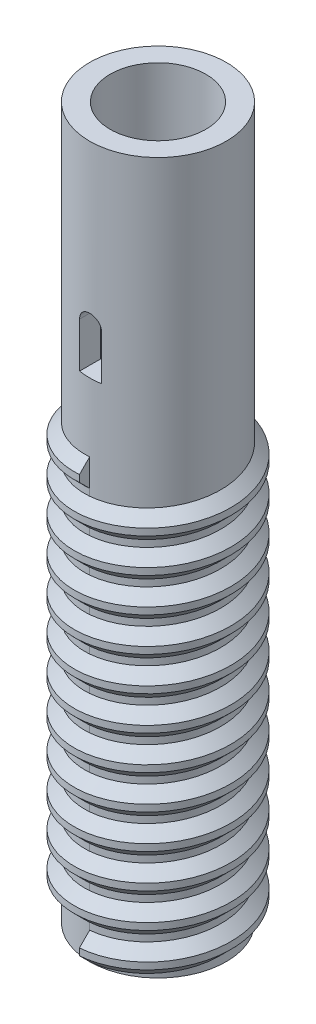
from build123d import *

# Parameters (mm, degrees)
SKETCH_1_R               = 10
EXTRUDE_1_DEPTH          = 14
SWEEP_1_PITCH            = 5
SKETCH_4_R               = 10
EXTRUDE_2_DEPTH          = 90
SKETCH_5_R               = 7
CUT_EXTRUDE_1_DEPTH      = 106.263954065
CUT_EXTRUDE_2_DEPTH      = 106.263954065
CUT_EXTRUDE_2_DEPTH_BACK = 106.263954065


with BuildPart() as part:
    # 草图1 → 凸台-拉伸1 (new body)
    with BuildSketch(Plane(origin=(0, 0, 0), x_dir=(1, 0, 0), z_dir=(0, 1, 0))):
        with Locations(Location((0, 0, 0), (0, 0, 270))):
            Circle(SKETCH_1_R)
    extrude(amount=EXTRUDE_1_DEPTH)

    # 扫描1: the profile of 草图3 profile screwed along a right-hand helix of 12 turns, 12 arcs to a turn; built about Z, then put on its axis
    sweep_1_z = Axis((0, 0, 0), (0, 0, 1))
    sweep_1_corners = [(9.9997, 0, 2.0003), (9.9997, 0, -2.0003), (11.5, 0, -0.5), (11.5, 0, 0.5)]
    with BuildLine(mode=Mode.PRIVATE) as sweep_1_profile:
        Line(sweep_1_corners[0], sweep_1_corners[1])
        Line(sweep_1_corners[1], sweep_1_corners[2])
        Line(sweep_1_corners[2], sweep_1_corners[3])
        Line(sweep_1_corners[3], sweep_1_corners[0])
    sweep_1_cap = Face(sweep_1_profile.wire())
    sweep_1_turn_angles = [0, 15, 30, 45, 60, 75, 90, 105, 120, 135, 150, 165, 180, 195, 210, 225, 240, 255, 270, 285, 300, 315, 330, 345, 360]
    sweep_1_turn_weights = [1, 0.9659258262890683, 1, 0.9659258262890683, 1, 0.9659258262890683, 1, 0.9659258262890683, 1, 0.9659258262890683, 1, 0.9659258262890683, 1, 0.9659258262890683, 1, 0.9659258262890683, 1, 0.9659258262890683, 1, 0.9659258262890683, 1, 0.9659258262890683, 1, 0.9659258262890683, 1]
    sweep_1_turn_rails = [Edge.make_bspline([Vector(p[0], p[1], 0).rotate(sweep_1_z, sweep_1_turn_angles[k]) / sweep_1_turn_weights[k] + Vector(0, 0, p[2] + SWEEP_1_PITCH * sweep_1_turn_angles[k] / 360) for k in range(25)], [0, 0, 0, 1, 1, 2, 2, 3, 3, 4, 4, 5, 5, 6, 6, 7, 7, 8, 8, 9, 9, 10, 10, 11, 11, 12, 12, 12], 2, sweep_1_turn_weights) for p in sweep_1_corners]
    sweep_1_turn_sides = [Face.make_surface_from_curves(sweep_1_turn_rails[p[0]], sweep_1_turn_rails[p[1]]) for p in [(0, 1), (1, 2), (2, 3), (3, 0)]]
    sweep_1 = Plane(origin=(0, 2, 0), x_dir=(0, 0, 1), z_dir=(0, 1, 0)) * Solid(Shell([*[p.moved(Location((0, 0, SWEEP_1_PITCH * i))) for i in range(12) for p in sweep_1_turn_sides], sweep_1_cap, sweep_1_cap.rotate(sweep_1_z, 4320).moved(Location((0, 0, SWEEP_1_PITCH * 4320 / 360)))]))
    add(sweep_1)

    # 草图4 → 凸台-拉伸2 (add)
    with BuildSketch(Plane(origin=(0, 14, 0), x_dir=(1, 0, 0), z_dir=(0, 1, 0))):
        with Locations(Location((0, 0, 0), (0, 0, 270))):
            Circle(SKETCH_4_R)
    extrude(amount=EXTRUDE_2_DEPTH)

    # 草图5 → 切除-拉伸1 (cut, through all)
    with BuildSketch(Plane.XZ):
        with Locations(Location((0, 0, 0), (0, 0, 270))):
            Circle(SKETCH_5_R)
    extrude(amount=-CUT_EXTRUDE_1_DEPTH, mode=Mode.SUBTRACT)

    # 草图6 → 切除-拉伸2 (cut, two sides: drawn at the far end of the back side and taken through both)
    with BuildSketch(Plane.XY.offset(-CUT_EXTRUDE_2_DEPTH_BACK)):
        with BuildLine():
            ThreePointArc((1.6, 80.6), (0, 82.2), (-1.6, 80.6))
            Line((-1.6, 80.6), (1.6, 80.6))
        make_face()
        with BuildLine():
            Line((1.6, 80.6), (-1.6, 80.6))
            ThreePointArc((-1.6, 80.6), (0, 79), (1.6, 80.6))
        make_face()
        with BuildLine():
            ThreePointArc((1.6, 80.6), (0, 79), (-1.6, 80.6))
            Line((-1.6, 80.6), (-1.6, 74))
            Line((-1.6, 74), (1.6, 74))
            Line((1.6, 74), (1.6, 80.6))
        make_face()
    extrude(amount=CUT_EXTRUDE_2_DEPTH + CUT_EXTRUDE_2_DEPTH_BACK, mode=Mode.SUBTRACT)


solid = part.part
